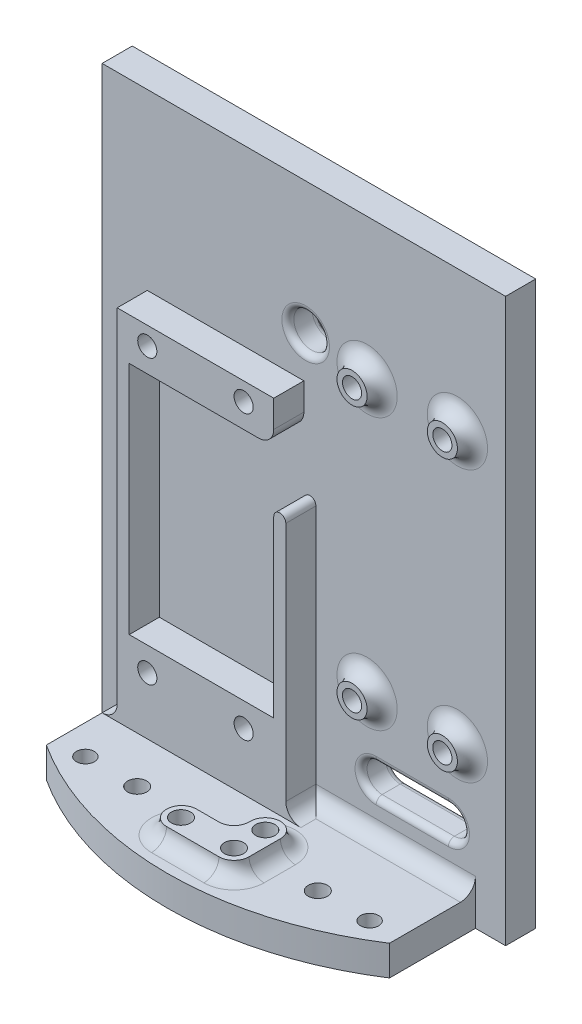
from build123d import *

# Parameters (mm, degrees)
SKETCH1_W                         = 85.09
SKETCH1_H                         = 118.618
BOSS1_MAIN_PLATE_DEPTH            = 6.35
BOSS2_BOTTOM_PLATE_DEPTH          = 6.35
BOSS3_BATTERY_PLATE_DEPTH         = 6.35
FILLET1_BOTTOM_PLATE_R            = 3.175
HOLES1_CB_MAIN_PLATE_D            = 4.0386
HOLES2_MAIN_PLATE_D               = 7.493
CUT1_MAIN_PLATE_DEPTH             = 6.35
FILLET2_MAIN_PLATE_HOLES_R        = 1.27
HOLES3_BOTTOM_PLATE_D             = 4.0386
SKETCH14_R                        = 3.175
BOSS4_MAIN_PLATE_STANDOFF_DEPTH   = 3.175
HOLES5_MAIN_PLATE_D               = 4.0386
FILLET3_MAIN_PLATE_STANDOFF_R     = 3.175
BOSS5_BOTTOM_PLATE_STANDOFF_DEPTH = 3.175
FILLET4_BOTTOM_PLATE_STANDOFF_R   = 3.175
HOLES6_BOTTOM_PLATE_D             = 4.0386
HOLES7_D                          = 3.7973


with BuildPart() as part:
    # Sketch1 → Boss1 - Main Plate (new body)
    with BuildSketch(Plane.XY):
        with Locations((42.545, 59.309)):
            Rectangle(SKETCH1_W, SKETCH1_H)
    extrude(amount=BOSS1_MAIN_PLATE_DEPTH)

    # Sketch3 → Boss2 - Bottom Plate (add)
    with BuildSketch(Plane.XZ):
        with BuildLine():
            Line((6.35, 24.47393552), (6.35, 0))
            Line((6.35, 0), (78.74, 0))
            Line((78.74, 0), (78.74, 24.47393552))
            ThreePointArc((78.74, 24.47393552), (42.545, 35.1536), (6.35, 24.47393552))
        make_face()
    extrude(amount=-BOSS2_BOTTOM_PLATE_DEPTH)

    # Sketch4 → Boss3 - Battery Plate (add)
    with BuildSketch(Plane.XY.offset(6.35)):
        with BuildLine():
            Line((9.525, 6.35), (45.085, 6.35))
            Line((45.085, 6.35), (45.085, 23.495))
            Line((45.085, 23.495), (45.085, 60.325))
            ThreePointArc((45.085, 60.325), (43.815, 61.595), (42.545, 60.325))
            Line((42.545, 60.325), (42.545, 23.495))
            Line((42.545, 23.495), (12.065, 23.495))
            Line((12.065, 23.495), (12.065, 73.025))
            Line((12.065, 73.025), (39.37, 73.025))
            ThreePointArc((39.37, 73.025), (41.61506403, 73.95493597), (42.545, 76.2))
            Line((42.545, 76.2), (42.545, 81.915))
            Line((42.545, 81.915), (9.525, 81.915))
            Line((9.525, 81.915), (9.525, 73.025))
            Line((9.525, 73.025), (9.525, 23.495))
            Line((9.525, 23.495), (9.525, 6.35))
        make_face()
    extrude(amount=BOSS3_BATTERY_PLATE_DEPTH)

    # Fillet1 - Bottom Plate
    fillet1_bottom_plate_edges = [part.edges().sort_by_distance(p)[0] for p in [
        (7.9375, 6.35, 6.35),
        (61.9125, 6.35, 6.35),
        (9.525, 6.35, 9.525),
        (45.085, 6.35, 9.525),
    ]]
    fillet(fillet1_bottom_plate_edges, radius=FILLET1_BOTTOM_PLATE_R - 0.0001)  # a hair under: the kernel refuses the full size

    # Holes1 - CB Main Plate (through all)
    with Locations(Plane(origin=(0, 0, 0), x_dir=(-1, 0, 0), z_dir=(0, 0, -1))):
        with Locations((-36.195, 78.105), (-15.875, 78.105), (-15.875, 18.415), (-36.195, 18.415)):
            Hole(HOLES1_CB_MAIN_PLATE_D / 2)

    # Holes2 - Main Plate (through all)
    with Locations(Plane(origin=(0, 0, 0), x_dir=(-1, 0, 0), z_dir=(0, 0, -1))):
        with Locations((-42.926, 90.805)):
            Hole(HOLES2_MAIN_PLATE_D / 2)

    # Sketch10 → Cut1 - Main Plate (cut)
    with BuildSketch(Plane(origin=(0, 0, 0), x_dir=(-1, 0, 0), z_dir=(0, 0, -1))):
        with BuildLine():
            Line((-73.025, 13.335), (-57.785, 13.335))
            ThreePointArc((-57.785, 13.335), (-54.61, 16.51), (-57.785, 19.685))
            Line((-57.785, 19.685), (-73.025, 19.685))
            ThreePointArc((-73.025, 19.685), (-76.2, 16.51), (-73.025, 13.335))
        make_face()
    extrude(amount=-CUT1_MAIN_PLATE_DEPTH, mode=Mode.SUBTRACT)

    # Fillet2 - Main Plate Holes
    fillet2_main_plate_holes_edges = [part.edges().sort_by_distance(p)[0] for p in [
        (39.1795, 90.805, 6.35),
        (39.1795, 90.805, 0),
        (76.2, 16.51, 0),
        (65.405, 13.335, 0),
        (54.61, 16.51, 0),
        (65.405, 19.685, 0),
        (65.405, 13.335, 6.35),
        (54.61, 16.51, 6.35),
        (65.405, 19.685, 6.35),
        (76.2, 16.51, 6.35),
    ]]
    fillet(fillet2_main_plate_holes_edges, radius=FILLET2_MAIN_PLATE_HOLES_R)

    # Holes3 - Bottom Plate (through all)
    with Locations(Plane(origin=(0, 0, 0), x_dir=(-1, 0, 0), z_dir=(0, -1, 0))):
        with Locations((-23.495, -22.4536), (-61.595, -22.4536)):
            Hole(HOLES3_BOTTOM_PLATE_D / 2)

    # Sketch14 → Boss4 - Main Plate Standoff (add)
    with BuildSketch(Plane.XY.offset(6.35)):
        with Locations((55.88, 88.9)):
            Circle(SKETCH14_R)
        with Locations((74.93, 88.9)):
            Circle(SKETCH14_R)
        with Locations((55.88, 31.75)):
            Circle(SKETCH14_R)
        with Locations((74.93, 31.75)):
            Circle(SKETCH14_R)
    extrude(amount=BOSS4_MAIN_PLATE_STANDOFF_DEPTH)

    # Holes5 - Main Plate (through all)
    with Locations(Plane.XY.offset(9.525)):
        with Locations((55.88, 88.9), (74.93, 88.9), (55.88, 31.75), (74.93, 31.75)):
            Hole(HOLES5_MAIN_PLATE_D / 2)

    # Fillet3 - Main Plate Standoff
    fillet3_main_plate_standoff_edges = [part.edges().sort_by_distance(p)[0] for p in [
        (52.705, 88.9, 6.35),
        (71.755, 88.9, 6.35),
        (52.705, 31.75, 6.35),
        (71.755, 31.75, 6.35),
    ]]
    fillet(fillet3_main_plate_standoff_edges, radius=FILLET3_MAIN_PLATE_STANDOFF_R - 0.0001)  # a hair under: the kernel refuses the full size

    # Sketch21 → Boss5 - Bottom Plate Standoff (add)
    with BuildSketch(Plane(origin=(0, 6.35, 0), x_dir=(1, 0, 0), z_dir=(0, 1, 0))):
        with BuildLine():
            Line((37.084, -23.495), (41.783, -23.495))
            ThreePointArc((41.783, -23.495), (44.02806403, -22.56506403), (44.958, -20.32))
            Line((44.958, -20.32), (44.958, -20.066))
            ThreePointArc((44.958, -20.066), (48.133, -16.891), (51.308, -20.066))
            Line((51.308, -20.066), (51.308, -26.67))
            ThreePointArc((51.308, -26.67), (50.37806403, -28.91506403), (48.133, -29.845))
            Line((48.133, -29.845), (37.084, -29.845))
            ThreePointArc((37.084, -29.845), (33.909, -26.67), (37.084, -23.495))
        make_face()
    extrude(amount=BOSS5_BOTTOM_PLATE_STANDOFF_DEPTH)

    # Fillet4 - Bottom Plate Standoff
    fillet4_bottom_plate_standoff_edges = [part.edges().sort_by_distance(p)[0] for p in [
        (39.4335, 6.35, 23.495),
        (44.02806403, 6.35, 22.56506403),
        (44.958, 6.35, 20.193),
        (48.133, 6.35, 16.891),
        (51.308, 6.35, 23.368),
        (50.37806403, 6.35, 28.91506403),
        (33.909, 6.35, 26.67),
        (42.6085, 6.35, 29.845),
    ]]
    fillet(fillet4_bottom_plate_standoff_edges, radius=FILLET4_BOTTOM_PLATE_STANDOFF_R - 0.0001)  # a hair under: the kernel refuses the full size

    # Holes6 - Bottom Plate (through all)
    with Locations(Plane(origin=(0, 0, 0), x_dir=(-1, 0, 0), z_dir=(0, -1, 0))):
        with Locations((-36.957, -26.67), (-48.133, -26.67), (-48.133, -20.066)):
            Hole(HOLES6_BOTTOM_PLATE_D / 2)

    # Holes7 (through all)
    with Locations(Plane(origin=(0, 6.35, 0), x_dir=(1, 0, 0), z_dir=(0, 1, 0))):
        with Locations((72.517, -22.4536), (12.573, -22.4536)):
            Hole(HOLES7_D / 2)


solid = part.part
